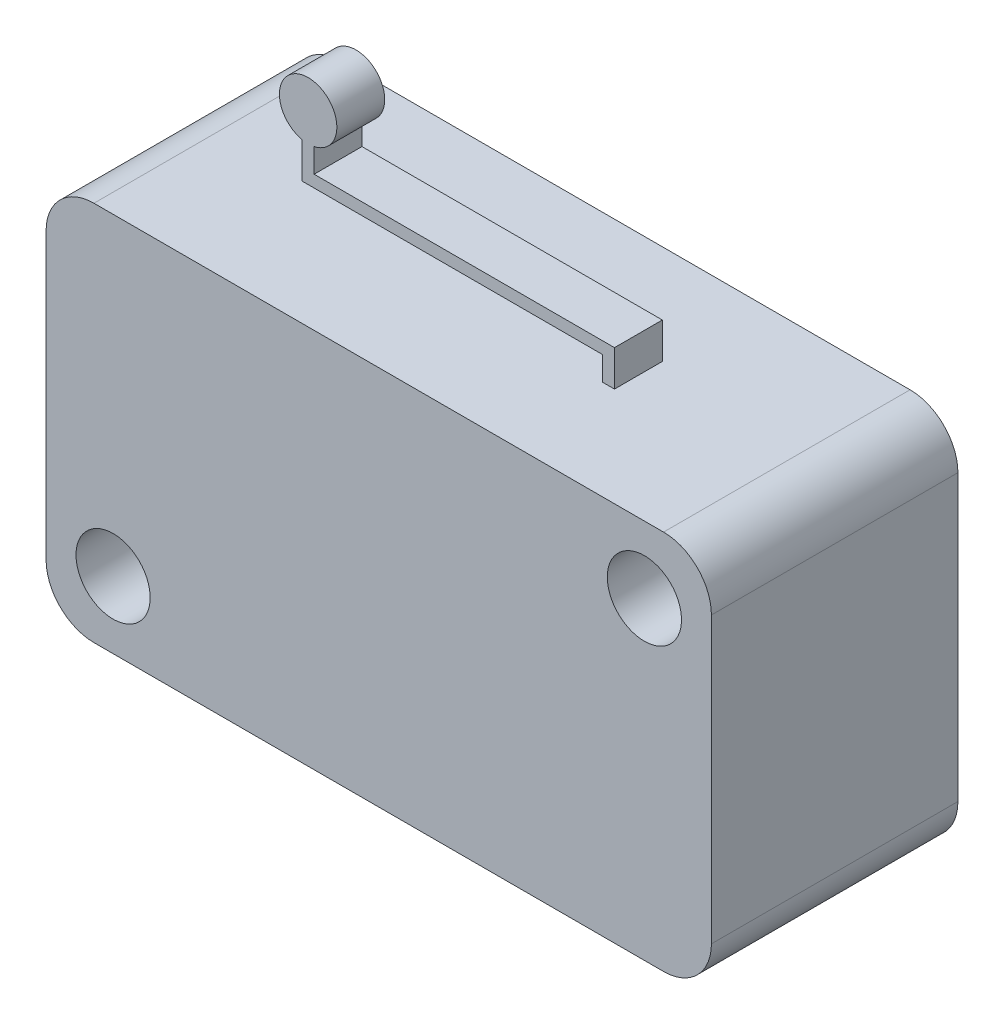
from build123d import *

# Parameters (mm, degrees)
SKETCH1_R                = 1.55
BOSS_EXTRUDE1_DEPTH      = 10.3
BOSS_EXTRUDE2_DEPTH      = 1
BOSS_EXTRUDE2_DEPTH_BACK = 1


with BuildPart() as part:
    # Sketch1 → Boss-Extrude1 (new body)
    with BuildSketch(Plane.XY):
        with BuildLine():
            Line((2, 0), (25.8, 0))
            ThreePointArc((25.8, 0), (27.214213562, 0.585786438), (27.8, 2))
            Line((27.8, 2), (27.8, 13.9))
            ThreePointArc((27.8, 13.9), (27.214213562, 15.314213562), (25.8, 15.9))
            Line((25.8, 15.9), (2, 15.9))
            ThreePointArc((2, 15.9), (0.585786438, 15.314213562), (0, 13.9))
            Line((0, 13.9), (0, 2))
            ThreePointArc((0, 2), (0.585786438, 0.585786438), (2, 0))
        make_face()
        with Locations((2.8, 2.8)):
            Circle(SKETCH1_R, mode=Mode.SUBTRACT)
        with Locations((25, 13.1)):
            Circle(SKETCH1_R, mode=Mode.SUBTRACT)
    extrude(amount=BOSS_EXTRUDE1_DEPTH)

    # Sketch2 → Boss-Extrude2 (add, two sides: drawn at the far end of the back side and taken through both)
    with BuildSketch(Plane.XY.offset(5.15).offset(-BOSS_EXTRUDE2_DEPTH_BACK)):
        with BuildLine():
            Line((6.55, 18.4), (6.55, 16.9))
            Line((6.55, 16.9), (7.05, 16.9))
            Line((7.05, 16.9), (19.1, 16.9))
            Line((19.1, 16.9), (19.1, 15.9))
            Line((19.1, 15.9), (19.6, 15.9))
            Line((19.6, 15.9), (19.6, 17.4))
            Line((19.6, 17.4), (7.05, 17.4))
            Line((7.05, 17.4), (7.05, 18.4))
            ThreePointArc((7.05, 18.4), (6.8, 20.773669459), (6.55, 18.4))
        make_face()
    extrude(amount=BOSS_EXTRUDE2_DEPTH + BOSS_EXTRUDE2_DEPTH_BACK)


solid = part.part
